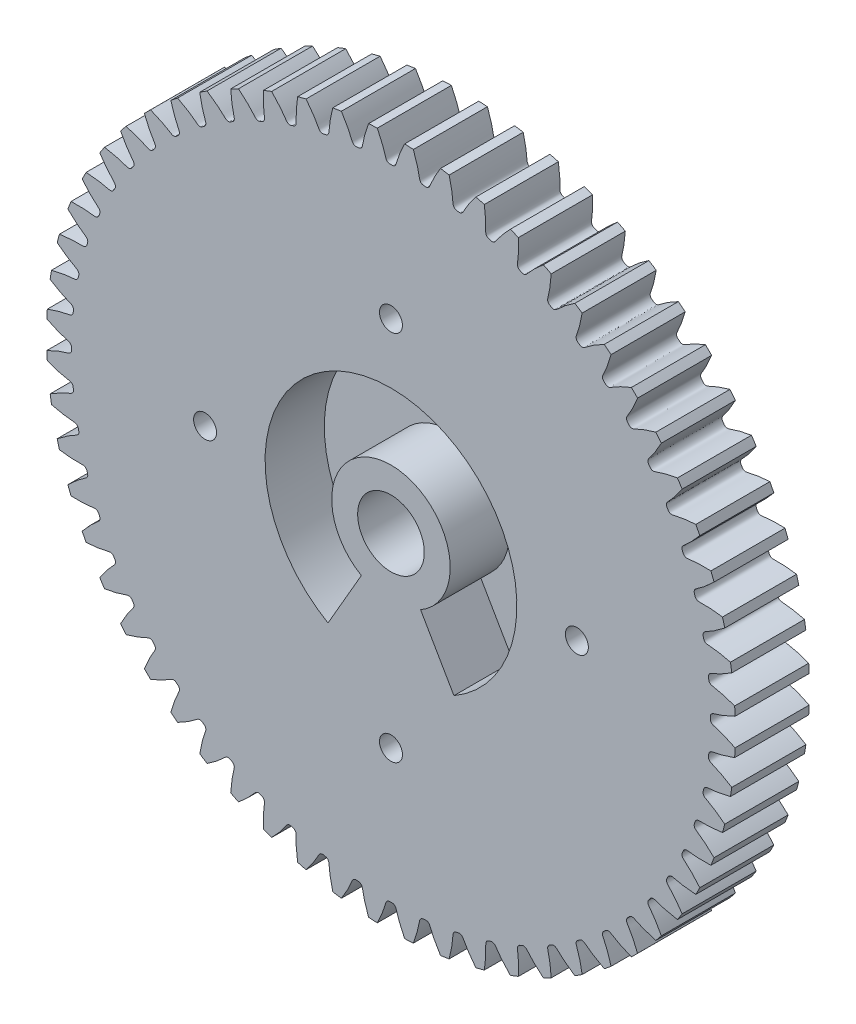
from build123d import *

# Parameters (mm, degrees)
SKETCHREVOLVESPURASSEMBLY01GEAR_W       = 10
SKETCHREVOLVESPURASSEMBLY01GEAR_H       = 46.499999302
TOOTHEXTRUDECUTSPURASSEMBLY01GEAR_DEPTH = 5
PATTERNSPURASSEMBLY01GEAR_COUNT         = 60
SKETCH5_R                               = 4.5
CUT_EXTRUDE2_DEPTH                      = 18
SKETCH6_R                               = 1.55
CUT_EXTRUDE3_DEPTH                      = 10
CIRPATTERN2_COUNT                       = 4
CUT_EXTRUDE4_DEPTH                      = 8
SKETCH7_R                               = 3.5
CUT_EXTRUDE5_DEPTH                      = 3


with BuildPart() as part:
    # SketchRevolveSpurAssembly01Gear → SpurAssembly01Gear (revolve)
    with BuildSketch(Plane(origin=(0, 0, 0), x_dir=(0, 0, -1), z_dir=(1, 0, 0))):
        with Locations((0, 23.249999651)):
            Rectangle(SKETCHREVOLVESPURASSEMBLY01GEAR_W, SKETCHREVOLVESPURASSEMBLY01GEAR_H)
    revolve(axis=Axis((0, 0, 0), (0, 0, -1)))

    # SketchToothSpurAssembly01Gear → ToothExtrudeCutSpurAssembly01Gear (cut, symmetric)
    with BuildSketch(Plane.XY):
        with BuildLine():
            ThreePointArc((46.536941888, 1.882445097), (46.574999301, 0), (46.536941888, -1.882445097))
            add(Edge.make_bspline(
                [(46.536941888, -1.882445097), (46.410580772, -1.817790323), (46.222345848, -1.724049646), (45.97247157, -1.604862074), (45.79126821, -1.520902479), (45.613955508, -1.441140119), (45.440604048, -1.365477285), (45.271282713, -1.293815196), (45.106058665, -1.226054069), (44.944997361, -1.162093066), (44.788162422, -1.101830604), (44.635616032, -1.045163354), (44.487417476, -0.991989937), (44.343628263, -0.942197901), (44.204293895, -0.895710038), (44.06950835, -0.852320586), (43.939186277, -0.812273822), (43.755364294, -0.756463501), (43.591162201, -0.718537687), (43.456933301, -0.660411719), (43.396978032, -0.628409971), (43.333262239, -0.585604909), (43.264730377, -0.524892475), (43.194956481, -0.436129591), (43.140009905, -0.315401482), (43.119097636, -0.163510161), (43.128214427, 0), (43.119097636, 0.163510161), (43.140009905, 0.315401482), (43.194956481, 0.436129591), (43.264730377, 0.524892475), (43.333262239, 0.585604909), (43.396978032, 0.628409971), (43.456933301, 0.660411719), (43.591162201, 0.718537687), (43.755364294, 0.756463501), (43.939186277, 0.812273822), (44.06950835, 0.852320586), (44.204293895, 0.895710038), (44.343628263, 0.942197901), (44.487417476, 0.991989937), (44.635616032, 1.045163354), (44.788162422, 1.101830604), (44.944997361, 1.162093066), (45.106058665, 1.226054069), (45.271282713, 1.293815196), (45.440604048, 1.365477285), (45.613955508, 1.441140119), (45.79126821, 1.520902479), (45.97247157, 1.604862074), (46.222345848, 1.724049646), (46.410580772, 1.817790323), (46.536941888, 1.882445097)],
                knots=[0, 0, 0, 0, 0.05176586, 0.076685537, 0.100963046, 0.124598386, 0.147591557, 0.16994256, 0.191651394, 0.21271806, 0.233142557, 0.252924885, 0.272065045, 0.290563036, 0.308418859, 0.325632513, 0.342203998, 0.358133315, 0.395728589, 0.403326908, 0.411414611, 0.420483419, 0.431260975, 0.444674611, 0.46138654, 0.478964563, 0.5, 0.521035437, 0.53861346, 0.555325389, 0.568739025, 0.579516581, 0.588585389, 0.596673092, 0.604271411, 0.641866685, 0.657796002, 0.674367487, 0.691581141, 0.709436964, 0.727934955, 0.747075115, 0.766857443, 0.78728194, 0.808348606, 0.83005744, 0.852408443, 0.875401614, 0.899036954, 0.923314463, 0.94823414, 1, 1, 1, 1], degree=3))
        make_face()
    toothextrudecutspurassembly01gear = extrude(amount=TOOTHEXTRUDECUTSPURASSEMBLY01GEAR_DEPTH, both=True, mode=Mode.SUBTRACT)

    # PatternSpurAssembly01Gear: ToothExtrudeCutSpurAssembly01Gear ×60 about axis
    patternspurassembly01gear_axis = Axis((0, 0, 5.5), (0, 0, -1))
    for i in range(1, PATTERNSPURASSEMBLY01GEAR_COUNT):
        add(toothextrudecutspurassembly01gear.rotate(patternspurassembly01gear_axis, i * 360 / PATTERNSPURASSEMBLY01GEAR_COUNT), mode=Mode.SUBTRACT)

    # Sketch5 → Cut-Extrude2 (cut)
    with BuildSketch(Plane(origin=(0, 0, -5), x_dir=(-1, 0, 0), z_dir=(0, 0, -1))):
        Circle(SKETCH5_R)
    extrude(amount=-CUT_EXTRUDE2_DEPTH, mode=Mode.SUBTRACT)

    # Sketch6 → Cut-Extrude3 (cut)
    with BuildSketch(Plane(origin=(0, 0, -5), x_dir=(-1, 0, 0), z_dir=(0, 0, -1))):
        with Locations((25.1, 0)):
            Circle(SKETCH6_R)
    cut_extrude3 = extrude(amount=-CUT_EXTRUDE3_DEPTH, mode=Mode.SUBTRACT)

    # CirPattern2: Cut-Extrude3 ×4 about axis
    cirpattern2_axis = Axis((0, 0, 5.5), (0, 0, -1))
    for i in range(1, CIRPATTERN2_COUNT):
        add(cut_extrude3.rotate(cirpattern2_axis, i * 360 / CIRPATTERN2_COUNT), mode=Mode.SUBTRACT)

    # Sketch4 → Cut-Extrude4 (cut)
    with BuildSketch(Plane.XY.offset(5)):
        with BuildLine():
            Line((-4, -6.92820323), (-8.5, -14.722431864))
            ThreePointArc((-8.5, -14.722431864), (0, 17), (8.5, -14.722431864))
            Line((8.5, -14.722431864), (4, -6.92820323))
            ThreePointArc((4, -6.92820323), (0, 8), (-4, -6.92820323))
        make_face()
    extrude(amount=-CUT_EXTRUDE4_DEPTH, mode=Mode.SUBTRACT)

    # Sketch7 → Cut-Extrude5 (cut)
    with BuildSketch(Plane(origin=(0, 0, -5), x_dir=(-1, 0, 0), z_dir=(0, 0, -1))):
        with Locations((-25.1, 0)):
            Circle(SKETCH7_R)
        with Locations((0, 25.1)):
            Circle(SKETCH7_R)
        with Locations((25.1, 0)):
            Circle(SKETCH7_R)
        with Locations((0, -25.1)):
            Circle(SKETCH7_R)
    extrude(amount=-CUT_EXTRUDE5_DEPTH, mode=Mode.SUBTRACT)


solid = part.part
